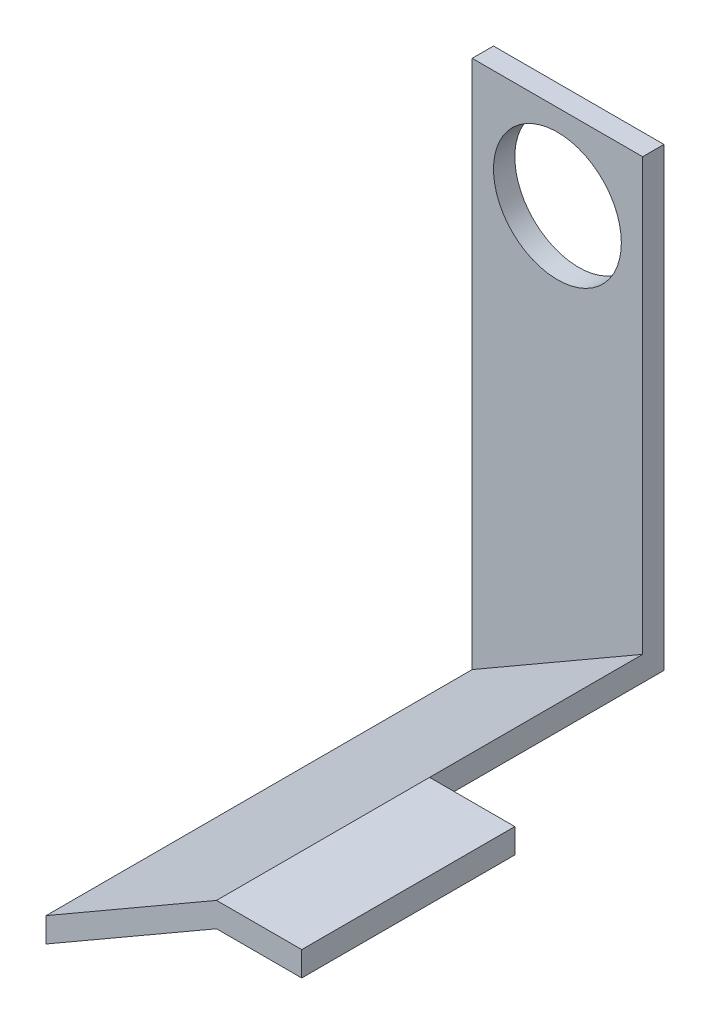
from build123d import *

# Parameters (mm, degrees)
SKETCH_4_R      = 1.5
EXTRUDE_3_DEPTH = 0.5
EXTRUDE_4_DEPTH = 10
SKETCH_6_W      = 5
SKETCH_6_H      = 0.577350269
EXTRUDE_5_DEPTH = 2


with BuildPart() as part:
    # Эскиз4 → Бобышка-Вытянуть3 (new body)
    with BuildSketch(Plane.XY):
        Polygon((-2, -7), (2, -4.690598923), (2, 6), (-2, 6), align=None)
        with Locations((0, 4)):
            Circle(SKETCH_4_R, mode=Mode.SUBTRACT)
    extrude(amount=EXTRUDE_3_DEPTH)

    # Эскиз5 → Бобышка-Вытянуть4 (add)
    with BuildSketch(Plane.XY.offset(0.5)):
        Polygon((-2, -7), (2, -4.690598923), (2, -4.113248654), (-2, -6.422649731), align=None)
    extrude(amount=EXTRUDE_4_DEPTH)

    # Эскиз6 → Бобышка-Вытянуть5 (add)
    with BuildSketch(Plane(origin=(2, 0, 0), x_dir=(0, 0, -1), z_dir=(1, 0, 0))):
        with Locations((-8, -4.401923789)):
            Rectangle(SKETCH_6_W, SKETCH_6_H)
    extrude(amount=EXTRUDE_5_DEPTH)


solid = part.part
